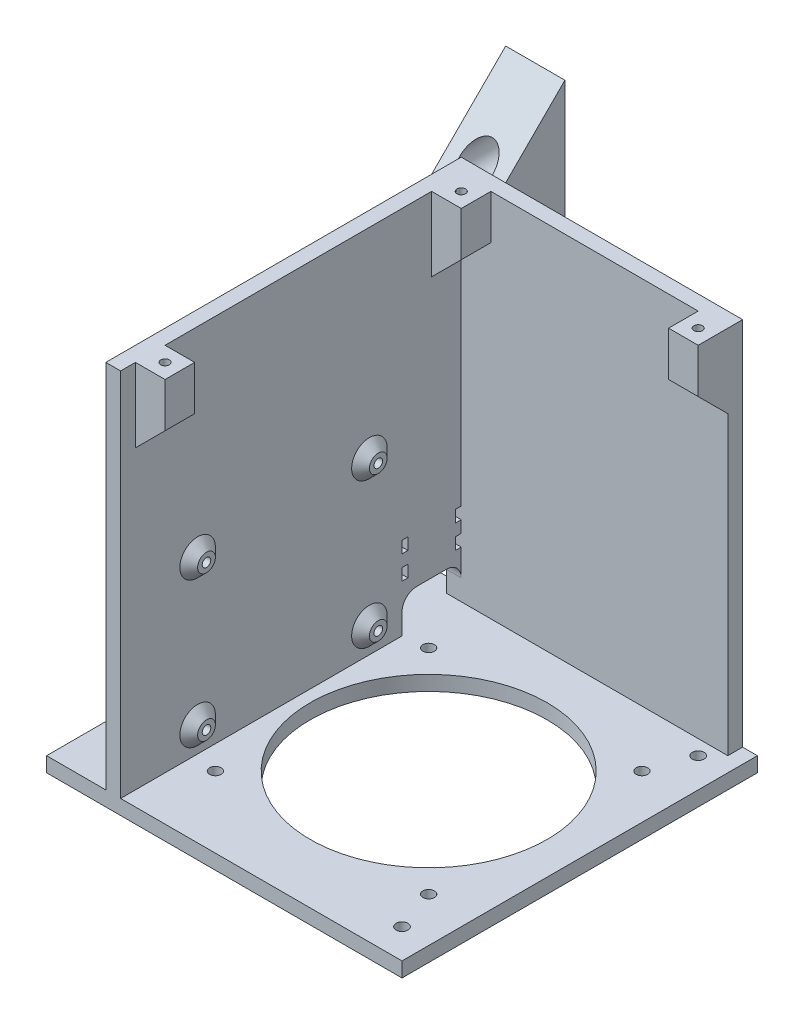
from build123d import *

# Parameters (mm, degrees)
SKETCH1_W               = 120
SKETCH1_H               = 120
BOSS_EXTRUDE1_DEPTH     = 5
SKETCH5_W               = 5
SKETCH5_H               = 120
BOSS_EXTRUDE3_DEPTH     = 125
SKETCH15_W              = 90
SKETCH15_H              = 5
BOSS_EXTRUDE9_DEPTH     = 125
SKETCH3_R               = 40
CUT_EXTRUDE1_DEPTH      = 15
SKETCH4_R               = 1.95
CUT_EXTRUDE2_DEPTH      = 15
SKETCH6_R               = 3
BOSS_EXTRUDE4_DEPTH     = 3
SKETCH7_R               = 1.45
CUT_EXTRUDE3_DEPTH      = 7
BOSS_EXTRUDE8_DEPTH     = 20
CUT_EXTRUDE6_DEPTH      = 236.212669727
CUT_EXTRUDE6_DEPTH_BACK = 236.212669727
SKETCH12_R              = 2.65
CHAMFER3_SIZE           = 3
SKETCH17_W              = 10
SKETCH17_H              = 10
BOSS_EXTRUDE10_DEPTH    = 15
CHAMFER4_SIZE           = 10
SKETCH18_R              = 2
CUT_EXTRUDE8_DEPTH      = 15
SKETCH19_R              = 1.45
CUT_EXTRUDE9_DEPTH      = 15
FILLET4_R               = 12
SKETCH20_R              = 2.65
CUT_EXTRUDE10_DEPTH     = 239.012604708
SKETCH21_R              = 5.5
CUT_EXTRUDE11_DEPTH     = 235.787137637
FILLET5_R               = 5
SKETCH23_W              = 20
SKETCH23_H              = 12
SKETCH23_W_2            = 2
SKETCH23_H_2            = 4
CUT_EXTRUDE12_DEPTH     = 10
FILLET6_R               = 5
FILLET7_R               = 2


with BuildPart() as part:
    # Sketch1 → Boss-Extrude1 (new body)
    with BuildSketch(Plane(origin=(0, 0, 0), x_dir=(1, 0, 0), z_dir=(0, 1, 0))):
        with Locations((60, 60)):
            Rectangle(SKETCH1_W, SKETCH1_H)
    extrude(amount=BOSS_EXTRUDE1_DEPTH)

    # Sketch5 → Boss-Extrude3 (add)
    with BuildSketch(Plane(origin=(0, 5, 0), x_dir=(1, 0, 0), z_dir=(0, 1, 0))):
        with Locations((22.5, 60)):
            Rectangle(SKETCH5_W, SKETCH5_H)
    extrude(amount=BOSS_EXTRUDE3_DEPTH)

    # Sketch15 → Boss-Extrude9 (add)
    with BuildSketch(Plane(origin=(0, 5, 0), x_dir=(1, 0, 0), z_dir=(0, 1, 0))):
        with Locations((70, 117.5)):
            Rectangle(SKETCH15_W, SKETCH15_H)
    extrude(amount=BOSS_EXTRUDE9_DEPTH)

    # Sketch3 → Cut-Extrude1 (cut)
    with BuildSketch(Plane.XZ):
        with Locations(Location((69, -60, 0), (0, 0, 270))):
            Circle(SKETCH3_R)
    extrude(amount=-CUT_EXTRUDE1_DEPTH, mode=Mode.SUBTRACT)

    # Sketch4 → Cut-Extrude2 (cut)
    with BuildSketch(Plane.XZ):
        with Locations(Location((33, -24, 0), (0, 0, 270))):
            Circle(SKETCH4_R)
        with Locations(Location((105, -24, 0), (0, 0, 270))):
            Circle(SKETCH4_R)
        with Locations(Location((105, -96, 0), (0, 0, 270))):
            Circle(SKETCH4_R)
        with Locations(Location((33, -96, 0), (0, 0, 270))):
            Circle(SKETCH4_R)
    extrude(amount=-CUT_EXTRUDE2_DEPTH, mode=Mode.SUBTRACT)

    # Sketch6 → Boss-Extrude4 (add)
    with BuildSketch(Plane(origin=(25, 0, 0), x_dir=(0, 0, -1), z_dir=(1, 0, 0))):
        with Locations(Location((26, 62.5, 0), (0, 0, 180))):
            Circle(SKETCH6_R)
        with Locations(Location((84, 62.5, 0), (0, 0, 180))):
            Circle(SKETCH6_R)
        with Locations(Location((84, 13.5, 0), (0, 0, 180))):
            Circle(SKETCH6_R)
        with Locations(Location((26, 13.5, 0), (0, 0, 180))):
            Circle(SKETCH6_R)
    extrude(amount=BOSS_EXTRUDE4_DEPTH)

    # Sketch7 → Cut-Extrude3 (cut)
    with BuildSketch(Plane(origin=(28, 0, 0), x_dir=(0, 0, -1), z_dir=(1, 0, 0))):
        with Locations((26, 62.5)):
            Circle(SKETCH7_R)
        with Locations((84, 62.5)):
            Circle(SKETCH7_R)
        with Locations((84, 13.5)):
            Circle(SKETCH7_R)
        with Locations((26, 13.5)):
            Circle(SKETCH7_R)
    extrude(amount=-CUT_EXTRUDE3_DEPTH, mode=Mode.SUBTRACT)

    # Sketch14 → Boss-Extrude8 (add)
    with BuildSketch(Plane.ZY):
        Polygon((-25, 5), (-65, 5), (-155, 95), (-155, 135), align=None)
    extrude(amount=-BOSS_EXTRUDE8_DEPTH)

    # Sketch12 → Cut-Extrude6 (cut, two sides: drawn at the far end of the back side and taken through both)
    with BuildSketch(Plane(origin=(0, 5, 0), x_dir=(1, 0, 0), z_dir=(0, 1, 0)).offset(-CUT_EXTRUDE6_DEPTH_BACK)):
        with Locations(Location((10, 105, 0), (0, 0, 90))):
            Circle(SKETCH12_R)
        with Locations(Location((10, 15, 0), (0, 0, 270))):
            Circle(SKETCH12_R)
    extrude(amount=CUT_EXTRUDE6_DEPTH + CUT_EXTRUDE6_DEPTH_BACK, mode=Mode.SUBTRACT)

    # Chamfer3
    chamfer3_edges = [part.edges().sort_by_distance(p)[0] for p in [
        (25, 62.5, -29),
        (25, 62.5, -87),
        (25, 13.5, -87),
        (25, 13.5, -29),
    ]]
    chamfer(chamfer3_edges, length=CHAMFER3_SIZE - 0.0001)  # a hair under: the kernel refuses the full size

    # Sketch17 → Boss-Extrude10 (add)
    with BuildSketch(Plane(origin=(0, 130, 0), x_dir=(1, 0, 0), z_dir=(0, 1, 0))):
        with Locations((30, 110)):
            Rectangle(SKETCH17_W, SKETCH17_H)
        with Locations((110, 110)):
            Rectangle(SKETCH17_W, SKETCH17_H)
        with Locations((30, 10)):
            Rectangle(SKETCH17_W, SKETCH17_H)
    extrude(amount=-BOSS_EXTRUDE10_DEPTH)

    # Chamfer4
    chamfer4_edges = [part.edges().sort_by_distance(p)[0] for p in [
        (110, 115, -115),
        (25, 115, -10),
        (25, 115, -110),
    ]]
    chamfer(chamfer4_edges, length=CHAMFER4_SIZE - 0.0001)  # a hair under: the kernel refuses the full size

    # Sketch18 → Cut-Extrude8 (cut)
    with BuildSketch(Plane(origin=(0, 5, 0), x_dir=(1, 0, 0), z_dir=(0, 1, 0))):
        with Locations(Location((110, 10, 0), (0, 0, 270))):
            Circle(SKETCH18_R)
        with Locations(Location((110, 110, 0), (0, 0, 270))):
            Circle(SKETCH18_R)
    extrude(amount=-CUT_EXTRUDE8_DEPTH, mode=Mode.SUBTRACT)

    # Sketch19 → Cut-Extrude9 (cut)
    with BuildSketch(Plane(origin=(0, 130, 0), x_dir=(1, 0, 0), z_dir=(0, 1, 0))):
        with Locations(Location((30, 110, 0), (0, 0, 270))):
            Circle(SKETCH19_R)
        with Locations(Location((110, 110, 0), (0, 0, 270))):
            Circle(SKETCH19_R)
        with Locations(Location((30, 10, 0), (0, 0, 270))):
            Circle(SKETCH19_R)
    extrude(amount=-CUT_EXTRUDE9_DEPTH, mode=Mode.SUBTRACT)

    # Fillet4
    fillet4_edges = [part.edges().sort_by_distance(p)[0] for p in [
        (10, 5, -65),
    ]]
    fillet(fillet4_edges, radius=FILLET4_R)

    # Sketch20 → Cut-Extrude10 (cut, through all)
    with BuildSketch(Plane(origin=(0, 0, -155), x_dir=(-1, 0, 0), z_dir=(0, 0, -1))):
        with Locations(Location((-10, 115, 0), (0, 0, 90))):
            Circle(SKETCH20_R)
    extrude(amount=-CUT_EXTRUDE10_DEPTH, mode=Mode.SUBTRACT)

    # Sketch21 → Cut-Extrude11 (cut, through all)
    with BuildSketch(Plane(origin=(0, 0, -150), x_dir=(-1, 0, 0), z_dir=(0, 0, -1))):
        with Locations(Location((-10, 115, 0), (0, 0, 90))):
            Circle(SKETCH21_R)
    extrude(amount=-CUT_EXTRUDE11_DEPTH, mode=Mode.SUBTRACT)

    # Fillet5
    fillet5_edges = [part.edges().sort_by_distance(p)[0] for p in [
        (20, 52.5, -72.5),
    ]]
    fillet(fillet5_edges, radius=FILLET5_R)

    # Sketch23 → Cut-Extrude12 (cut)
    with BuildSketch(Plane(origin=(25, 0, 0), x_dir=(0, 0, -1), z_dir=(1, 0, 0))):
        with Locations((105, 11)):
            Rectangle(SKETCH23_W, SKETCH23_H)
        with Locations((96, 23)):
            Rectangle(SKETCH23_W_2, SKETCH23_H_2)
        with Locations((114, 23)):
            Rectangle(SKETCH23_W_2, SKETCH23_H_2)
        with Locations((114, 31)):
            Rectangle(SKETCH23_W_2, SKETCH23_H_2)
        with Locations((96, 31)):
            Rectangle(SKETCH23_W_2, SKETCH23_H_2)
    extrude(amount=-CUT_EXTRUDE12_DEPTH, mode=Mode.SUBTRACT)

    # Fillet6
    fillet6_edges = [part.edges().sort_by_distance(p)[0] for p in [
        (22.5, 17, -115),
        (22.5, 17, -95),
    ]]
    fillet(fillet6_edges, radius=FILLET6_R)

    # Fillet7
    fillet7_edges = [part.edges().sort_by_distance(p)[0] for p in [
        (20, 31, -113),
        (20, 31, -97),
        (20, 23, -113),
        (20, 23, -97),
    ]]
    fillet(fillet7_edges, radius=FILLET7_R)


solid = part.part
